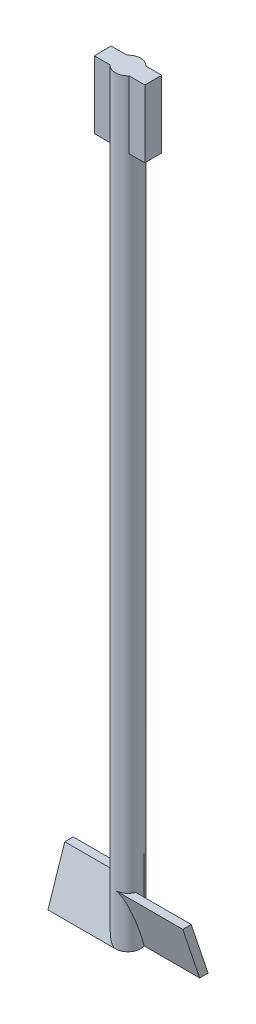
from build123d import *

# Parameters (mm, degrees)
SKETCH1_R           = 1.5
BOSS_EXTRUDE1_DEPTH = 90
SKETCH2_W           = 6
SKETCH2_H           = 2
BOSS_EXTRUDE2_DEPTH = 8
BOSS_EXTRUDE3_DEPTH = 8
BOSS_EXTRUDE4_DEPTH = 8


with BuildPart() as part:
    # Sketch1 → Boss-Extrude1 (new body)
    with BuildSketch(Plane(origin=(0, 0, 0), x_dir=(1, 0, 0), z_dir=(0, 1, 0))):
        Circle(SKETCH1_R)
    extrude(amount=BOSS_EXTRUDE1_DEPTH)

    # Sketch2 → Boss-Extrude2 (add)
    with BuildSketch(Plane(origin=(0, 90, 0), x_dir=(1, 0, 0), z_dir=(0, 1, 0))):
        Rectangle(SKETCH2_W, SKETCH2_H)
    extrude(amount=-BOSS_EXTRUDE2_DEPTH)

    # Sketch3 → Boss-Extrude3 (add)
    with BuildSketch(Plane(origin=(0, 0, 0), x_dir=(0, 0, -1), z_dir=(1, 0, 0))):
        Polygon((-1.5, 6), (-0.5, 6), (1.5, 0), (0.5, 0), align=None)
    extrude(amount=BOSS_EXTRUDE3_DEPTH)

    # Sketch4 → Boss-Extrude4 (add)
    with BuildSketch(Plane(origin=(0, 0, 0), x_dir=(0, 0, -1), z_dir=(1, 0, 0))):
        Polygon((1.5, 6), (0.5, 6), (-1.5, 0), (-0.5, 0), align=None)
    extrude(amount=-BOSS_EXTRUDE4_DEPTH)


solid = part.part
